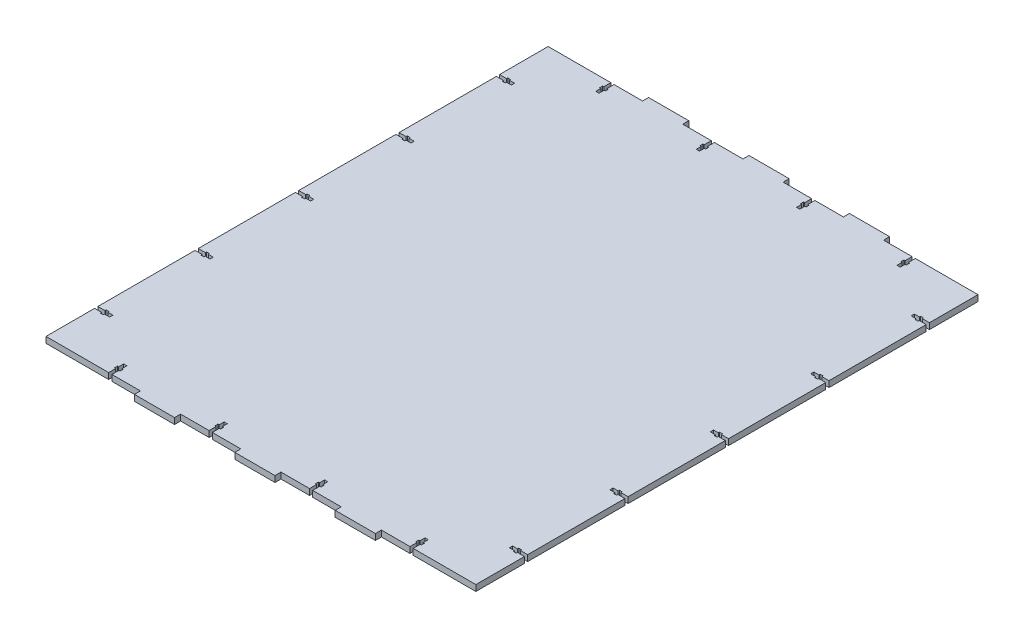
from build123d import *

# Parameters (mm, degrees)
SKETCH1_W           = 428
SKETCH1_H           = 500
BOSS_EXTRUDE1_DEPTH = 6
SKETCH2_W           = 40
SKETCH2_H           = 6
BOSS_EXTRUDE2_DEPTH = 6
CUT_EXTRUDE1_DEPTH  = 334.718444201


with BuildPart() as part:
    # Sketch1 → Boss-Extrude1 (new body)
    with BuildSketch(Plane(origin=(0, 0, 0), x_dir=(1, 0, 0), z_dir=(0, 1, 0))):
        Rectangle(SKETCH1_W, SKETCH1_H)
    extrude(amount=BOSS_EXTRUDE1_DEPTH)

    # Sketch2 → Boss-Extrude2 (add)
    with BuildSketch(Plane.XZ):
        with Locations((-100, 253)):
            Rectangle(SKETCH2_W, SKETCH2_H)
        with Locations((0, 253)):
            Rectangle(SKETCH2_W, SKETCH2_H)
        with Locations((100, 253)):
            Rectangle(SKETCH2_W, SKETCH2_H)
        with Locations((100, -253)):
            Rectangle(SKETCH2_W, SKETCH2_H)
        with Locations((0, -253)):
            Rectangle(SKETCH2_W, SKETCH2_H)
        with Locations((-100, -253)):
            Rectangle(SKETCH2_W, SKETCH2_H)
    extrude(amount=-BOSS_EXTRUDE2_DEPTH)

    # Sketch3 → Cut-Extrude1 (cut, through all)
    with BuildSketch(Plane.XZ):
        Polygon((-151.6, -243), (-151.6, -250), (-148.4, -250), (-148.4, -243), (-147.2, -243), (-147.2, -240), (-148.4, -240), (-148.4, -235), (-151.6, -235), (-151.6, -240), (-152.8, -240), (-152.8, -243), align=None)
        Polygon((-148.4, 250), (-151.6, 250), (-151.6, 243), (-152.8, 243), (-152.8, 240), (-151.6, 240), (-151.6, 235), (-148.4, 235), (-148.4, 240), (-147.2, 240), (-147.2, 243), (-148.4, 243), align=None)
        Polygon((-214, 201.6), (-214, 198.4), (-207, 198.4), (-207, 197.2), (-204, 197.2), (-204, 198.4), (-199, 198.4), (-199, 201.6), (-204, 201.6), (-204, 202.8), (-207, 202.8), (-207, 201.6), align=None)
        Polygon((-214, 101.6), (-214, 98.4), (-207, 98.4), (-207, 97.2), (-204, 97.2), (-204, 98.4), (-199, 98.4), (-199, 101.6), (-204, 101.6), (-204, 102.8), (-207, 102.8), (-207, 101.6), align=None)
        Polygon((-214, 1.6), (-214, -1.6), (-207, -1.6), (-207, -2.8), (-204, -2.8), (-204, -1.6), (-199, -1.6), (-199, 1.6), (-204, 1.6), (-204, 2.8), (-207, 2.8), (-207, 1.6), align=None)
        Polygon((-214, -98.4), (-214, -101.6), (-207, -101.6), (-207, -102.8), (-204, -102.8), (-204, -101.6), (-199, -101.6), (-199, -98.4), (-204, -98.4), (-204, -97.2), (-207, -97.2), (-207, -98.4), align=None)
        Polygon((-204, -201.6), (-199, -201.6), (-199, -198.4), (-204, -198.4), (-204, -197.2), (-207, -197.2), (-207, -198.4), (-214, -198.4), (-214, -201.6), (-207, -201.6), (-207, -202.8), (-204, -202.8), align=None)
        Polygon((151.6, 243), (151.6, 250), (148.4, 250), (148.4, 243), (147.2, 243), (147.2, 240), (148.4, 240), (148.4, 235), (151.6, 235), (151.6, 240), (152.8, 240), (152.8, 243), align=None)
        Polygon((148.4, -250), (151.6, -250), (151.6, -243), (152.8, -243), (152.8, -240), (151.6, -240), (151.6, -235), (148.4, -235), (148.4, -240), (147.2, -240), (147.2, -243), (148.4, -243), align=None)
        Polygon((214, -201.6), (214, -198.4), (207, -198.4), (207, -197.2), (204, -197.2), (204, -198.4), (199, -198.4), (199, -201.6), (204, -201.6), (204, -202.8), (207, -202.8), (207, -201.6), align=None)
        Polygon((214, -101.6), (214, -98.4), (207, -98.4), (207, -97.2), (204, -97.2), (204, -98.4), (199, -98.4), (199, -101.6), (204, -101.6), (204, -102.8), (207, -102.8), (207, -101.6), align=None)
        Polygon((214, -1.6), (214, 1.6), (207, 1.6), (207, 2.8), (204, 2.8), (204, 1.6), (199, 1.6), (199, -1.6), (204, -1.6), (204, -2.8), (207, -2.8), (207, -1.6), align=None)
        Polygon((214, 98.4), (214, 101.6), (207, 101.6), (207, 102.8), (204, 102.8), (204, 101.6), (199, 101.6), (199, 98.4), (204, 98.4), (204, 97.2), (207, 97.2), (207, 98.4), align=None)
        Polygon((204, 202.8), (204, 201.6), (199, 201.6), (199, 198.4), (204, 198.4), (204, 197.2), (207, 197.2), (207, 198.4), (214, 198.4), (214, 201.6), (207, 201.6), (207, 202.8), align=None)
        Polygon((-48.4, -235), (-51.6, -235), (-51.6, -240), (-52.8, -240), (-52.8, -243), (-51.6, -243), (-51.6, -250), (-48.4, -250), (-48.4, -243), (-47.2, -243), (-47.2, -240), (-48.4, -240), align=None)
        Polygon((51.6, -235), (48.4, -235), (48.4, -240), (47.2, -240), (47.2, -243), (48.4, -243), (48.4, -250), (51.6, -250), (51.6, -243), (52.8, -243), (52.8, -240), (51.6, -240), align=None)
        Polygon((51.6, 235), (51.6, 240), (52.8, 240), (52.8, 243), (51.6, 243), (51.6, 250), (48.4, 250), (48.4, 243), (47.2, 243), (47.2, 240), (48.4, 240), (48.4, 235), align=None)
        Polygon((-48.4, 235), (-48.4, 240), (-47.2, 240), (-47.2, 243), (-48.4, 243), (-48.4, 250), (-51.6, 250), (-51.6, 243), (-52.8, 243), (-52.8, 240), (-51.6, 240), (-51.6, 235), align=None)
    extrude(amount=-CUT_EXTRUDE1_DEPTH, mode=Mode.SUBTRACT)


solid = part.part
